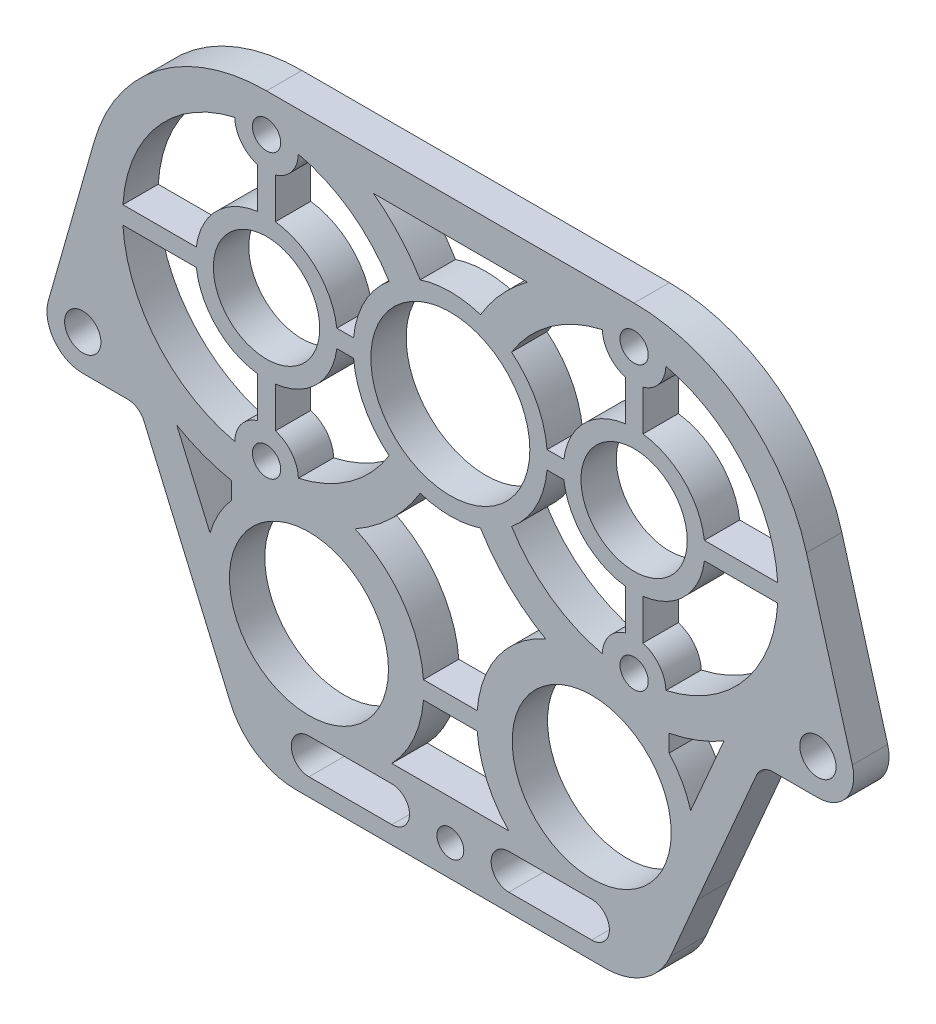
from build123d import *

# Parameters (mm, degrees)
SKETCH1_R           = 3.2639
SKETCH1_R_2         = 14.2875
SKETCH1_R_3         = 2.54
SKETCH1_R_4         = 2.413
SKETCH1_R_5         = 9.5504
BOSS_EXTRUDE1_DEPTH = 6.35
FILLET1_R           = 12.7


with BuildPart() as part:
    # Sketch1 → Boss-Extrude1 (new body)
    with BuildSketch(Plane.XY):
        with BuildLine():
            ThreePointArc((-88.650082996, -56.773293074), (-88.69014681, -56.910298001), (-88.729603024, -57.047479146))
            Line((-88.729603024, -57.047479146), (-96.969555254, -85.936940817))
            ThreePointArc((-96.969555254, -85.936940817), (-95.917203646, -91.581675778), (-90.777596546, -94.141932707))
            Line((-90.777596546, -94.141932707), (-82.731084461, -94.141932707))
            ThreePointArc((-82.731084461, -94.141932707), (-80.96163914, -94.671787652), (-79.774622093, -96.086946138))
            Line((-79.774622093, -96.086946138), (-69.089278393, -120.875011159))
            Line((-69.089278393, -120.875011159), (-60.977424177, -139.773032707))
            Line((-60.977424177, -139.773032707), (11.502231084, -139.773032707))
            Line((11.502231084, -139.773032707), (19.6140853, -120.875011159))
            Line((19.6140853, -120.875011159), (30.299429001, -96.086946138))
            ThreePointArc((30.299429001, -96.086946138), (31.486446047, -94.671787652), (33.255891369, -94.141932707))
            Line((33.255891369, -94.141932707), (41.302403454, -94.141932707))
            ThreePointArc((41.302403454, -94.141932707), (46.442010554, -91.581675778), (47.494362162, -85.936940817))
            Line((47.494362162, -85.936940817), (39.254409932, -57.047479146))
            ThreePointArc((39.254409932, -57.047479146), (39.214953717, -56.910298001), (39.174889904, -56.773293074))
            ThreePointArc((39.174889904, -56.773293074), (27.569139848, -40.087517091), (8.282403454, -33.674222013))
            Line((8.282403454, -33.674222013), (-57.757596546, -33.674222013))
            ThreePointArc((-57.757596546, -33.674222013), (-77.04433294, -40.087517091), (-88.650082996, -56.773293074))
        make_face()
        with BuildLine():
            ThreePointArc((-35.245526509, -130.248032707), (-32.070526509, -133.423032707), (-35.245526509, -136.598032707))
            Line((-35.245526509, -136.598032707), (-50.137596546, -136.598032707))
            ThreePointArc((-50.137596546, -136.598032707), (-53.312596546, -133.423032707), (-50.137596546, -130.248032707))
            Line((-50.137596546, -130.248032707), (-35.245526509, -130.248032707))
        make_face(mode=Mode.SUBTRACT)
        with BuildLine():
            Line((-67.920135277, -107.552502272), (-73.889402884, -93.757371434))
            ThreePointArc((-73.889402884, -93.757371434), (-69.125593396, -96.015661334), (-64.057187193, -97.466527514))
            Line((-64.057187193, -97.466527514), (-64.057187193, -100.544279198))
            ThreePointArc((-64.057187193, -100.544279198), (-66.371359185, -103.837446777), (-67.920135277, -107.552502272))
        make_face(mode=Mode.SUBTRACT)
        with Locations((-90.777596546, -87.703032707)):
            Circle(SKETCH1_R, mode=Mode.SUBTRACT)
        with Locations((-50.137596546, -112.785532707)):
            Circle(SKETCH1_R_2, mode=Mode.SUBTRACT)
        with Locations((-57.757596546, -91.281422013)):
            Circle(SKETCH1_R_3, mode=Mode.SUBTRACT)
        with Locations((-24.737596546, -134.185032707)):
            Circle(SKETCH1_R_4, mode=Mode.SUBTRACT)
        with BuildLine():
            ThreePointArc((0.662403454, -130.248032707), (3.837403454, -133.423032707), (0.662403454, -136.598032707))
            Line((0.662403454, -136.598032707), (-14.229666584, -136.598032707))
            ThreePointArc((-14.229666584, -136.598032707), (-17.404666584, -133.423032707), (-14.229666584, -130.248032707))
            Line((-14.229666584, -130.248032707), (0.662403454, -130.248032707))
        make_face(mode=Mode.SUBTRACT)
        with BuildLine():
            ThreePointArc((-19.913948264, -114.373032707), (-18.174388615, -121.216527358), (-14.229666584, -127.073032707))
            Line((-14.229666584, -127.073032707), (-35.245526509, -127.073032707))
            ThreePointArc((-35.245526509, -127.073032707), (-31.300804477, -121.216527358), (-29.561244829, -114.373032707))
            Line((-29.561244829, -114.373032707), (-19.913948264, -114.373032707))
        make_face(mode=Mode.SUBTRACT)
        with Locations((0.662403454, -112.785532707)):
            Circle(SKETCH1_R_2, mode=Mode.SUBTRACT)
        with BuildLine():
            Line((-19.913948264, -111.198032707), (-29.561244829, -111.198032707))
            ThreePointArc((-29.561244829, -111.198032707), (-33.30837049, -100.840510455), (-41.849292426, -93.885521568))
            ThreePointArc((-41.849292426, -93.885521568), (-35.26870111, -88.93686202), (-30.157880835, -82.481404678))
            ThreePointArc((-30.157880835, -82.481404678), (-24.737596546, -83.343922013), (-19.317312258, -82.481404678))
            ThreePointArc((-19.317312258, -82.481404678), (-14.206491982, -88.93686202), (-7.625900666, -93.885521568))
            ThreePointArc((-7.625900666, -93.885521568), (-16.166822602, -100.840510455), (-19.913948264, -111.198032707))
        make_face(mode=Mode.SUBTRACT)
        with Locations((8.282403454, -91.281422013)):
            Circle(SKETCH1_R_3, mode=Mode.SUBTRACT)
        with BuildLine():
            ThreePointArc((14.581994101, -97.466527514), (19.650400303, -96.015661334), (24.414209791, -93.757371434))
            Line((24.414209791, -93.757371434), (18.444942185, -107.552502272))
            ThreePointArc((18.444942185, -107.552502272), (16.896166093, -103.837446777), (14.581994101, -100.544279198))
            Line((14.581994101, -100.544279198), (14.581994101, -97.466527514))
        make_face(mode=Mode.SUBTRACT)
        with Locations((41.302403454, -87.703032707)):
            Circle(SKETCH1_R, mode=Mode.SUBTRACT)
        with BuildLine():
            Line((-59.345096546, -78.50741302), (-59.345096546, -85.791333785))
            ThreePointArc((-59.345096546, -85.791333785), (-62.270471472, -87.774972968), (-63.469709832, -91.099799313))
            ThreePointArc((-63.469709832, -91.099799313), (-77.455074137, -82.632665799), (-83.566018342, -67.468922013))
            Line((-83.566018342, -67.468922013), (-70.383587553, -67.468922013))
            ThreePointArc((-70.383587553, -67.468922013), (-66.755813179, -74.879638646), (-59.345096546, -78.50741302))
        make_face(mode=Mode.SUBTRACT)
        with BuildLine():
            ThreePointArc((-52.04548326, -91.099799313), (-53.24472162, -87.774972968), (-56.170096546, -85.791333785))
            Line((-56.170096546, -85.791333785), (-56.170096546, -78.50741302))
            ThreePointArc((-56.170096546, -78.50741302), (-48.759379913, -74.879638646), (-45.131605539, -67.468922013))
            Line((-45.131605539, -67.468922013), (-42.127787747, -67.468922013))
            ThreePointArc((-42.127787747, -67.468922013), (-40.144805677, -74.10071718), (-35.740996219, -79.441071783))
            ThreePointArc((-35.740996219, -79.441071783), (-42.717587518, -86.914560635), (-52.04548326, -91.099799313))
        make_face(mode=Mode.SUBTRACT)
        with Locations((-57.757596546, -65.881422013)):
            Circle(SKETCH1_R_5, mode=Mode.SUBTRACT)
        with BuildLine():
            ThreePointArc((-59.345096546, -53.255431006), (-66.755813179, -56.88320538), (-70.383587553, -64.293922013))
            Line((-70.383587553, -64.293922013), (-83.566018342, -64.293922013))
            ThreePointArc((-83.566018342, -64.293922013), (-77.455074137, -49.130178227), (-63.469709832, -40.663044713))
            ThreePointArc((-63.469709832, -40.663044713), (-62.270471472, -43.987871058), (-59.345096546, -45.971510241))
            Line((-59.345096546, -45.971510241), (-59.345096546, -53.255431006))
        make_face(mode=Mode.SUBTRACT)
        with BuildLine():
            Line((-56.170096546, -53.255431006), (-56.170096546, -45.971510241))
            ThreePointArc((-56.170096546, -45.971510241), (-53.24472162, -43.987871058), (-52.04548326, -40.663044713))
            ThreePointArc((-52.04548326, -40.663044713), (-42.717587518, -44.848283391), (-35.740996219, -52.321772243))
            ThreePointArc((-35.740996219, -52.321772243), (-40.144805677, -57.662126846), (-42.127787747, -64.293922013))
            Line((-42.127787747, -64.293922013), (-45.131605539, -64.293922013))
            ThreePointArc((-45.131605539, -64.293922013), (-48.759379913, -56.88320538), (-56.170096546, -53.255431006))
        make_face(mode=Mode.SUBTRACT)
        with Locations((-57.757596546, -40.481422013)):
            Circle(SKETCH1_R_3, mode=Mode.SUBTRACT)
        with BuildLine():
            Line((-38.555801318, -40.024222013), (-10.919391775, -40.024222013))
            ThreePointArc((-10.919391775, -40.024222013), (-15.571723543, -44.241543153), (-19.317312258, -49.281439348))
            ThreePointArc((-19.317312258, -49.281439348), (-24.737596546, -48.418922013), (-30.157880835, -49.281439348))
            ThreePointArc((-30.157880835, -49.281439348), (-33.90346955, -44.241543153), (-38.555801318, -40.024222013))
        make_face(mode=Mode.SUBTRACT)
        with BuildLine():
            Line((-7.347405345, -67.468922013), (-4.343587553, -67.468922013))
            ThreePointArc((-4.343587553, -67.468922013), (-0.715813179, -74.879638646), (6.694903454, -78.50741302))
            Line((6.694903454, -78.50741302), (6.694903454, -85.791333785))
            ThreePointArc((6.694903454, -85.791333785), (3.769528528, -87.774972968), (2.570290168, -91.099799313))
            ThreePointArc((2.570290168, -91.099799313), (-6.757605574, -86.914560635), (-13.734196873, -79.441071783))
            ThreePointArc((-13.734196873, -79.441071783), (-9.330387415, -74.10071718), (-7.347405345, -67.468922013))
        make_face(mode=Mode.SUBTRACT)
        with Locations((-24.737596546, -65.881422013)):
            Circle(SKETCH1_R_2, mode=Mode.SUBTRACT)
        with Locations((8.282403454, -65.881422013)):
            Circle(SKETCH1_R_5, mode=Mode.SUBTRACT)
        with BuildLine():
            ThreePointArc((9.869903454, -78.50741302), (17.280620087, -74.879638646), (20.908394461, -67.468922013))
            Line((20.908394461, -67.468922013), (34.09082525, -67.468922013))
            ThreePointArc((34.09082525, -67.468922013), (27.979881045, -82.632665799), (13.99451674, -91.099799313))
            ThreePointArc((13.99451674, -91.099799313), (12.79527838, -87.774972968), (9.869903454, -85.791333785))
            Line((9.869903454, -85.791333785), (9.869903454, -78.50741302))
        make_face(mode=Mode.SUBTRACT)
        with BuildLine():
            ThreePointArc((6.694903454, -53.255431006), (-0.715813179, -56.88320538), (-4.343587553, -64.293922013))
            Line((-4.343587553, -64.293922013), (-7.347405345, -64.293922013))
            ThreePointArc((-7.347405345, -64.293922013), (-9.330387415, -57.662126846), (-13.734196873, -52.321772243))
            ThreePointArc((-13.734196873, -52.321772243), (-6.757605574, -44.848283391), (2.570290168, -40.663044713))
            ThreePointArc((2.570290168, -40.663044713), (3.769528528, -43.987871058), (6.694903454, -45.971510241))
            Line((6.694903454, -45.971510241), (6.694903454, -53.255431006))
        make_face(mode=Mode.SUBTRACT)
        with Locations((8.282403454, -40.481422013)):
            Circle(SKETCH1_R_3, mode=Mode.SUBTRACT)
        with BuildLine():
            Line((9.869903454, -53.255431006), (9.869903454, -45.971510241))
            ThreePointArc((9.869903454, -45.971510241), (12.79527838, -43.987871058), (13.99451674, -40.663044713))
            ThreePointArc((13.99451674, -40.663044713), (27.979881045, -49.130178227), (34.09082525, -64.293922013))
            Line((34.09082525, -64.293922013), (20.908394461, -64.293922013))
            ThreePointArc((20.908394461, -64.293922013), (17.280620087, -56.88320538), (9.869903454, -53.255431006))
        make_face(mode=Mode.SUBTRACT)
    extrude(amount=BOSS_EXTRUDE1_DEPTH)

    # Fillet1
    fillet1_edges = [part.edges().sort_by_distance(p)[0] for p in [
        (-60.977424177, -139.773032707, 3.175),
        (11.502231084, -139.773032707, 3.175),
    ]]
    fillet(fillet1_edges, radius=FILLET1_R)


solid = part.part
